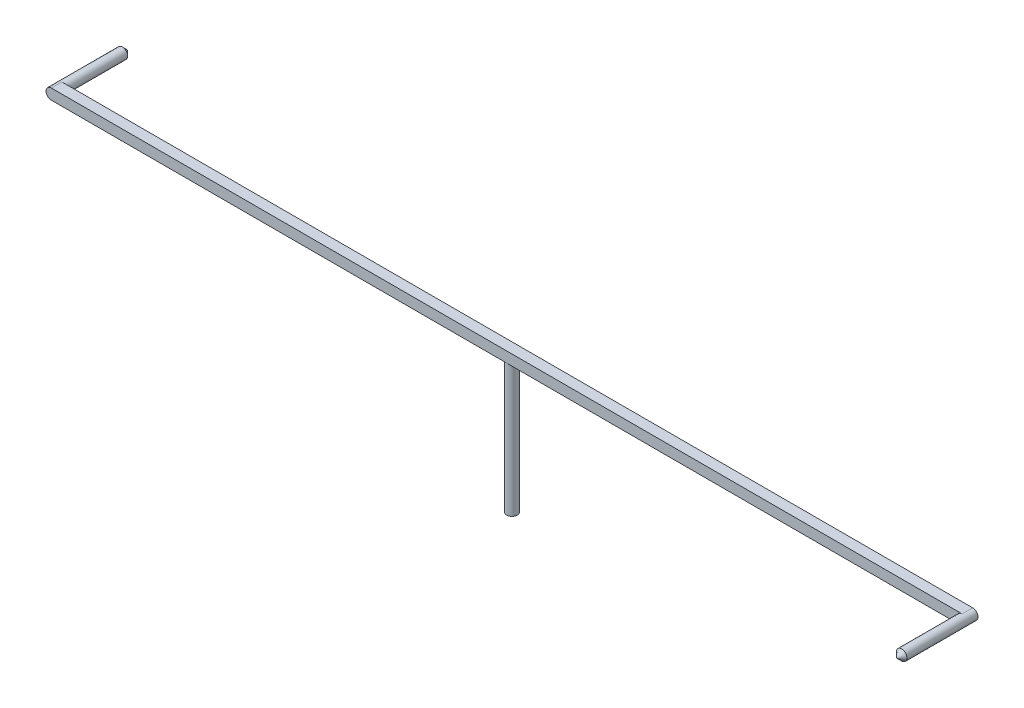
from build123d import *

# Parameters (mm, degrees)
SKETCH_1_R      = 0.4
EXTRUDE_1_DEPTH = 10
SKETCH_2_W      = 70
SKETCH_2_H      = 0.8
EXTRUDE_2_DEPTH = 0.8
FILLET_1_R      = 0.4
SKETCH_3_R      = 0.4
EXTRUDE_3_DEPTH = 5
SKETCH_4_R      = 0.4
EXTRUDE_4_DEPTH = 5
CHAMFER_1_SIZE  = 0.4


with BuildPart() as part:
    # 草图1 → 凸台-拉伸1 (new body)
    with BuildSketch(Plane(origin=(0, 0, 0), x_dir=(1, 0, 0), z_dir=(0, 1, 0))):
        with Locations(Location((0, 0, 0), (0, 0, 270))):
            Circle(SKETCH_1_R)
    extrude(amount=EXTRUDE_1_DEPTH)

    # 草图2 → 凸台-拉伸2 (add)
    with BuildSketch(Plane(origin=(0, 10, 0), x_dir=(1, 0, 0), z_dir=(0, 1, 0))):
        Rectangle(SKETCH_2_W, SKETCH_2_H)
    extrude(amount=EXTRUDE_2_DEPTH)

    # 圆角1
    fillet_1_edges = [part.edges().sort_by_distance(p)[0] for p in [
        (35, 10, 0),
        (35, 10.8, 0),
        (-35, 10, 0),
        (-35, 10.8, 0),
    ]]
    fillet(fillet_1_edges, radius=FILLET_1_R - 0.0001)  # a hair under: the kernel refuses the full size

    # 草图3 → 凸台-拉伸3 (add)
    with BuildSketch(Plane.XY.offset(0.4)):
        with Locations((34.6, 10.4)):
            Circle(SKETCH_3_R)
    extrude(amount=EXTRUDE_3_DEPTH)

    # 草图4 → 凸台-拉伸4 (add)
    with BuildSketch(Plane(origin=(0, 0, -0.4), x_dir=(-1, 0, 0), z_dir=(0, 0, -1))):
        with Locations((34.6, 10.4)):
            Circle(SKETCH_4_R)
    extrude(amount=EXTRUDE_4_DEPTH)

    # 倒角1
    chamfer_1_edges = [part.edges().sort_by_distance(p)[0] for p in [
        (34.2, 10.4, 5.4),
        (-34.2, 10.4, -5.4),
    ]]
    chamfer(chamfer_1_edges, length=CHAMFER_1_SIZE - 0.0001)  # a hair under: the kernel refuses the full size


solid = part.part
